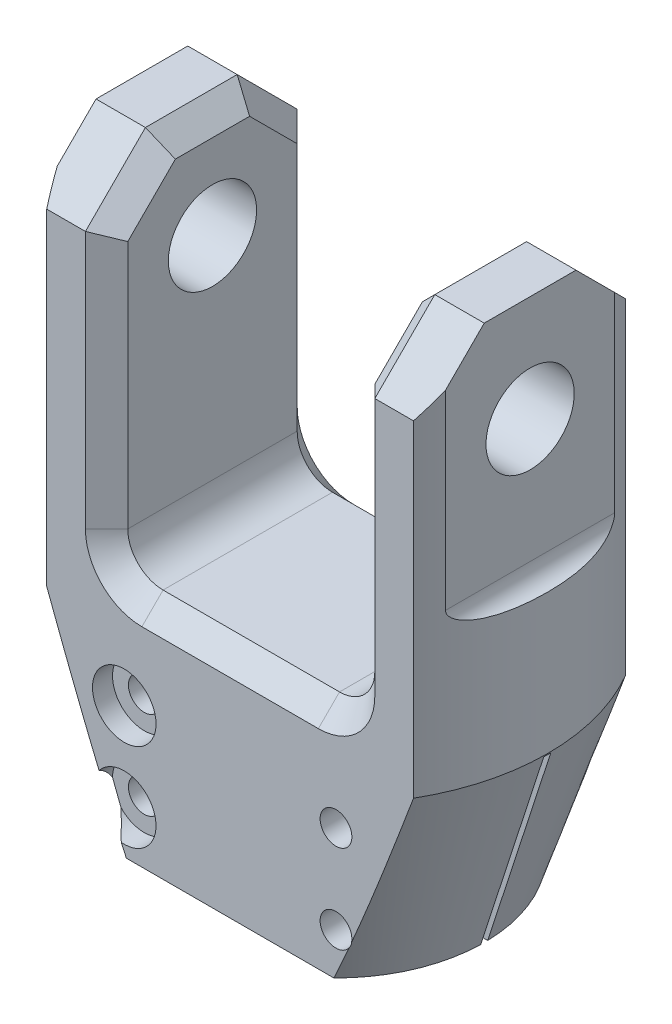
from build123d import *

# Parameters (mm, degrees)
SKETCH_1_R                   = 60
EXTRUDE_1_DEPTH              = 165
SKETCH_2_W                   = 30
SKETCH_2_H                   = 165
CUT_EXTRUDE_1_DEPTH          = 82.5
HOLE_WIZARD_3_0_3_1_D        = 43.4
HOLE_WIZARD_3_0_3_1_DEPTH    = 46
HOLE_WIZARD_3_0_3_1_TIP      = 13.038675433
SKETCH_6_W                   = 70
SKETCH_6_H                   = 100
CUT_EXTRUDE_2_DEPTH          = 186.539753153
SKETCH_7_W                   = 5
SKETCH_7_H                   = 70
CUT_EXTRUDE_3_DEPTH          = 82.5
M27X2_0_1_D                  = 25
FILLET_1_R                   = 10
CHAMFER_1_SIZE               = 17
CHAMFER_2_SIZE               = 6
FILLET_2_R                   = 5
SKETCH_11_W                  = 140.236598901
SKETCH_11_H                  = 2
CUT_EXTRUDE_4_DEPTH          = 55
HOLE_WIZARD_M8_1_D           = 9
HOLE_WIZARD_M8_1_CBORE_D     = 18.01
HOLE_WIZARD_M8_1_CBORE_DEPTH = 5.68
PATTERN_CIRCULAR_1_COUNT     = 2


# Some blends are built 0.0001 mm under size
with BuildPart() as part:
    # 草圖1 → 填料-伸長1 (new body)
    with BuildSketch(Plane(origin=(0, 0, 0), x_dir=(1, 0, 0), z_dir=(0, 1, 0))):
        with Locations(Location((0, 0, 0), (0, 0, 270))):
            Circle(SKETCH_1_R)
    extrude(amount=EXTRUDE_1_DEPTH)

    # 草圖2 → 除料-伸長1 (cut, symmetric)
    with BuildSketch(Plane(origin=(0, 0, 0), x_dir=(0, 0, -1), z_dir=(1, 0, 0))):
        with Locations((-45, 82.5)):
            Rectangle(SKETCH_2_W, SKETCH_2_H)
        with Locations((45, 82.5)):
            Rectangle(SKETCH_2_W, SKETCH_2_H)
    extrude(amount=CUT_EXTRUDE_1_DEPTH, both=True, mode=Mode.SUBTRACT)

    # Ø3.0 (3) 直徑孔1
    with Locations(Plane.XZ):
        with Locations((0, 0)):
            Hole(HOLE_WIZARD_3_0_3_1_D / 2, depth=HOLE_WIZARD_3_0_3_1_DEPTH)
            with Locations((0, 0, -(HOLE_WIZARD_3_0_3_1_DEPTH + HOLE_WIZARD_3_0_3_1_TIP / 2))):  # 118° drill point
                Cone(0, HOLE_WIZARD_3_0_3_1_D / 2, HOLE_WIZARD_3_0_3_1_TIP, mode=Mode.SUBTRACT)

    # 草圖6 → 除料-伸長2 (cut, through all)
    with BuildSketch(Plane.XY.offset(30)):
        with Locations((0, 115)):
            Rectangle(SKETCH_6_W, SKETCH_6_H)
    extrude(amount=-CUT_EXTRUDE_2_DEPTH, mode=Mode.SUBTRACT)

    # 草圖7 → 除料-伸長3 (cut, symmetric)
    with BuildSketch(Plane.XY):
        with Locations((-57.5, 130)):
            Rectangle(SKETCH_7_W, SKETCH_7_H)
        with Locations((57.5, 130)):
            Rectangle(SKETCH_7_W, SKETCH_7_H)
    extrude(amount=CUT_EXTRUDE_3_DEPTH, both=True, mode=Mode.SUBTRACT)

    # M27x2.0 螺紋孔1 (through all)
    with Locations(Plane.ZY.offset(55)):
        with Locations((0, 135)):
            Hole(M27X2_0_1_D / 2)

    # 圓角1
    fillet_1_edges = [part.edges().sort_by_distance(p)[0] for p in [
        (-35, 65, 0),
        (35, 65, 0),
    ]]
    fillet(fillet_1_edges, radius=FILLET_1_R)

    # 導角1
    # the kernel refuses this chamfer: 17 mm, written as the material it takes off along each edge
    with BuildSketch(Plane(origin=(-8.718610795, 165, -30), x_dir=(0, 0.027495876610587052, 0.9996219169112966), z_dir=(1, 0, 0)), Plane(origin=(-95.680135022, 165, -30), x_dir=(0, 0.027495876610587052, 0.9996219169112966), z_dir=(1, 0, 0))) as chamfer_1_piece_1:
        Polygon((CHAMFER_1_SIZE * 0.999621916911, CHAMFER_1_SIZE * 0.0274958766106), (-CHAMFER_1_SIZE * 0.0274958766106, CHAMFER_1_SIZE * 0.999621916911), (0, 0), align=None)
    extrude(amount=104.398745818, mode=Mode.SUBTRACT)
    with BuildSketch(Plane(origin=(95.680135022, 165, 30), x_dir=(0, -0.9996219169112966, 0.027495876610586622), z_dir=(-1, 0, 0)), Plane(origin=(8.718610795, 165, 30), x_dir=(0, -0.9996219169112966, 0.027495876610586622), z_dir=(-1, 0, 0))) as chamfer_1_piece_2:
        Polygon((CHAMFER_1_SIZE * 0.999621916911, -CHAMFER_1_SIZE * 0.0274958766106), (-CHAMFER_1_SIZE * 0.0274958766106, -CHAMFER_1_SIZE * 0.999621916911), (0, 0), align=None)
    extrude(amount=104.398745818, mode=Mode.SUBTRACT)

    # 導角2
    chamfer_2_edges = [part.edges().sort_by_distance(p)[0] for p in [
        (35, 111.5, 30),
        (35, 111.5, -30),
        (0, 65, 30),
        (0, 65, -30),
        (32.071067812, 67.928932188, 30),
        (32.071067812, 67.928932188, -30),
        (-32.071067812, 67.928932188, 30),
        (-32.071067812, 67.928932188, -30),
        (-35, 111.5, -30),
        (35, 165, 0),
        (35, 156.5, 21.5),
        (35, 156.5, -21.5),
        (-35, 111.5, 30),
        (-35, 165, 0),
        (-35, 156.5, 21.5),
        (-35, 156.5, -21.5),
    ]]
    chamfer(chamfer_2_edges, length=CHAMFER_2_SIZE)

    # 圓角2
    fillet_2_edges = [part.edges().sort_by_distance(p)[0] for p in [
        (55, 95, 0),
        (-55, 95, 0),
    ]]
    fillet(fillet_2_edges, radius=FILLET_2_R - 0.0001)  # a hair under: the kernel refuses the full size

    # 草圖10 → 除料-旋轉1 (revolve, cut)
    with BuildSketch(Plane.XY, mode=Mode.PRIVATE) as cut_revolve_1_sk:
        Polygon((-42, 0), (-63.119780255, 65), (-77.803628401, 65), (-77.803628401, 0), align=None)
    revolve(cut_revolve_1_sk.sketch.rotate(Axis((0, -1000, 0), (0, 1, 0)), 270), axis=Axis((0, -1000, 0), (0, 1, 0)), mode=Mode.SUBTRACT)

    # 草圖11 → 除料-伸長4 (cut)
    with BuildSketch(Plane.XZ):
        with Locations((2.553977794, 0)):
            Rectangle(SKETCH_11_W, SKETCH_11_H)
    extrude(amount=-CUT_EXTRUDE_4_DEPTH, mode=Mode.SUBTRACT)

    # M8 六角頭螺栓的柱孔1 (through all)
    with Locations(Plane.XY.offset(30)):
        with Locations((-30, 37.131132576), (-30, 12.131132576)):
            hole_wizard_m8_1 = CounterBoreHole(HOLE_WIZARD_M8_1_D / 2, HOLE_WIZARD_M8_1_CBORE_D / 2, HOLE_WIZARD_M8_1_CBORE_DEPTH)

    # 環狀複製排列1: M8 六角頭螺栓的柱孔1 ×2 about axis
    pattern_circular_1_axis = Axis((0, 165, 0), (0, -1, 0))
    for i in range(1, PATTERN_CIRCULAR_1_COUNT):
        add(hole_wizard_m8_1.rotate(pattern_circular_1_axis, i * 360 / PATTERN_CIRCULAR_1_COUNT), mode=Mode.SUBTRACT)


solid = part.part
